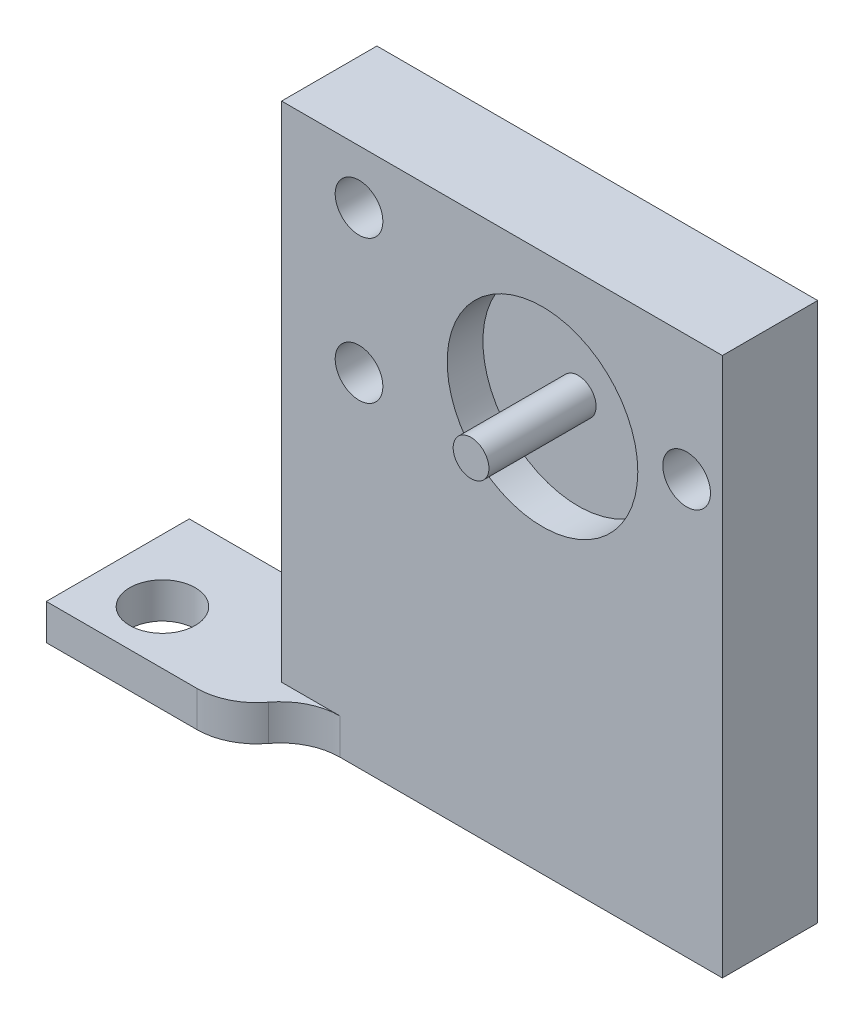
from build123d import *

# Parameters (mm, degrees)
ESQUISSE1_W             = 37
ESQUISSE1_H             = 42.25
ESQUISSE1_R             = 6
BOSS_EXTRU_1_DEPTH      = 12
ESQUISSE2_R             = 6
ESQUISSE2_R_2           = 1.5
ENL_V_MAT_EXTRU_1_DEPTH = 3
ESQUISSE3_W             = 37
ESQUISSE3_H             = 12
ESQUISSE3_W_2           = 15.75
ESQUISSE3_R             = 2.75
BOSS_EXTRU_2_DEPTH      = 3
ESQUISSE4_W             = 37
ESQUISSE4_H             = 45.25
ESQUISSE4_R             = 8
ENL_V_MAT_EXTRU_2_DEPTH = 4
ESQUISSE4_3_R           = 8
ESQUISSE4_3_R_2         = 6
ESQUISSE4_3_R_3         = 1.5
ENL_V_MAT_EXTRU_4_DEPTH = 7
CONG_2_R                = 5
CONG_3_R                = 5
ESQUISSE5_R             = 2
ENL_V_MAT_EXTRU_5_DEPTH = 43.650652105
BOSS_EXTRU_3_START      = 2
ESQUISSE2_2_R           = 1.5
BOSS_EXTRU_3_DEPTH      = 2


with BuildPart() as part:
    # Esquisse1 → Boss.-Extru.1 (new body)
    # profile 1 of 2: a face of its own
    with BuildSketch(Plane.XY):
        Rectangle(ESQUISSE1_W, ESQUISSE1_H)
        with Locations((3.4, 9.125)):
            Circle(ESQUISSE1_R, mode=Mode.SUBTRACT)
    # profile 2 of 2: a face of its own
    with BuildSketch(Plane.XY):
        with Locations((3.4, 9.125)):
            Circle(ESQUISSE1_R)
    extrude(amount=BOSS_EXTRU_1_DEPTH)

    # Esquisse2 → Enlèv. mat.-Extru.1 (cut)
    with BuildSketch(Plane.XY.offset(12)):
        with Locations((3.4, 9.125)):
            Circle(ESQUISSE2_R)
        with Locations((3.4, 9.125)):
            Circle(ESQUISSE2_R_2, mode=Mode.SUBTRACT)
    extrude(amount=-ENL_V_MAT_EXTRU_1_DEPTH, mode=Mode.SUBTRACT)

    # Esquisse3 → Boss.-Extru.2 (add)
    # profile 1 of 2: a face of its own
    with BuildSketch(Plane.XZ.offset(21.125)):
        with Locations((0, 6)):
            Rectangle(ESQUISSE3_W, ESQUISSE3_H)
    # profile 2 of 2: a face of its own
    with BuildSketch(Plane.XZ.offset(21.125)):
        with Locations((-26.375, 6)):
            Rectangle(ESQUISSE3_W_2, ESQUISSE3_H)
        with Locations((-29, 7.5)):
            Circle(ESQUISSE3_R, mode=Mode.SUBTRACT)
    extrude(amount=BOSS_EXTRU_2_DEPTH)

    # Esquisse4 → Enlèv. mat.-Extru.2 (cut)
    with BuildSketch(Plane.XY.offset(12)):
        with Locations((0, -1.5)):
            Rectangle(ESQUISSE4_W, ESQUISSE4_H)
        with Locations((3.4, 9.125)):
            Circle(ESQUISSE4_R, mode=Mode.SUBTRACT)
    extrude(amount=-ENL_V_MAT_EXTRU_2_DEPTH, mode=Mode.SUBTRACT)

    # Esquisse4<3> → Enlèv. mat.-Extru.4 (cut)
    # profile 1 of 2: a face of its own
    with BuildSketch(Plane.XY.offset(12)):
        with Locations((3.4, 9.125)):
            Circle(ESQUISSE4_3_R)
        with Locations((3.4, 9.125)):
            Circle(ESQUISSE4_3_R_2, mode=Mode.SUBTRACT)
    # profile 2 of 2: a face of its own
    with BuildSketch(Plane.XY.offset(12)):
        with Locations((3.4, 9.125)):
            Circle(ESQUISSE4_3_R_2)
        with Locations((3.4, 9.125)):
            Circle(ESQUISSE4_3_R_3, mode=Mode.SUBTRACT)
    extrude(amount=-ENL_V_MAT_EXTRU_4_DEPTH, mode=Mode.SUBTRACT)

    # Congé2
    # the kernel refuses this fillet: 5 mm, written as the material it adds along each edge
    with BuildSketch(Plane(origin=(-18.5, -24.125, 8), x_dir=(1.5667467323505199e-12, 0, 1.0), z_dir=(0, 1, 0))) as cong_2_piece_1:
        with BuildLine():
            CenterArc((5, 4.898979486), CONG_2_R, 180, 78.463040967)
            Line((0, 4.898979486), (0, 0))
            Line((0, 0), (4, 0))
        make_face()
    extrude(amount=3)

    # Congé3
    cong_3_edges = [part.edges().sort_by_distance(p)[0] for p in [
        (-18.5, -22.625, 12),
    ]]
    fillet(cong_3_edges, radius=CONG_3_R)

    # Esquisse5 → Enlèv. mat.-Extru.5 (cut, through all)
    with BuildSketch(Plane.XY.offset(8)):
        with Locations((-12, 16.625)):
            Circle(ESQUISSE5_R)
        with Locations((-12, 4.625)):
            Circle(ESQUISSE5_R)
        with Locations((15.5, 10.625)):
            Circle(ESQUISSE5_R)
    extrude(amount=-ENL_V_MAT_EXTRU_5_DEPTH, mode=Mode.SUBTRACT)

    # Esquisse2<2> → Boss.-Extru.3 (add)
    with BuildSketch(Plane.XY.offset(12).offset(BOSS_EXTRU_3_START)):
        with Locations((3.4, 9.125)):
            Circle(ESQUISSE2_2_R)
    extrude(amount=-BOSS_EXTRU_3_DEPTH)


solid = part.part
